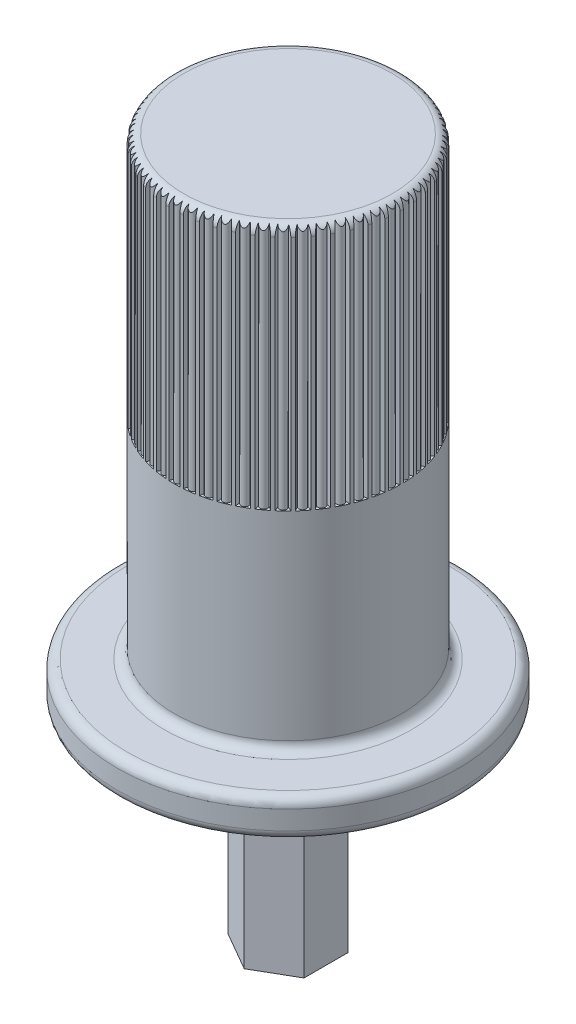
from build123d import *

# Parameters (mm, degrees)
FILLET1_R           = 0.25
CUT_EXTRUDE1_DEPTH  = 6.5
CIRPATTERN1_COUNT   = 50
FILLET2_R           = 0.25
BOSS_EXTRUDE1_DEPTH = 5.5


with BuildPart() as part:
    # Sketch1 → Revolve1 (revolve)
    with BuildSketch(Plane.XY):
        Polygon((0, 0), (0, 13), (-3, 13), (-3, 1), (-4.5, 1), (-4.5, 0), align=None)
    revolve(axis=Axis((0, 0, 0), (0, 1, 0)))

    # Fillet1
    fillet1_edges = [part.edges().sort_by_distance(p)[0] for p in [
        (3, 13, 0),
    ]]
    fillet(fillet1_edges, radius=FILLET1_R)

    # Sketch2 → Cut-Extrude1 (cut)
    with BuildSketch(Plane(origin=(0, 13, 0), x_dir=(1, 0, 0), z_dir=(0, 1, 0))):
        with BuildLine():
            Line((-0.099984876, 2.87326087), (-0.25, 3.27326087))
            Line((-0.25, 3.27326087), (0.25, 3.27326087))
            Line((0.25, 3.27326087), (0.099984876, 2.87326087))
            ThreePointArc((0.099984876, 2.87326087), (0, 2.975), (-0.099984876, 2.87326087))
        make_face()
    cut_extrude1 = extrude(amount=-CUT_EXTRUDE1_DEPTH, mode=Mode.SUBTRACT)

    # CirPattern1: Cut-Extrude1 ×50 about axis
    cirpattern1_axis = Axis((0, 0, 0), (0, -1, 0))
    for i in range(1, CIRPATTERN1_COUNT):
        add(cut_extrude1.rotate(cirpattern1_axis, i * 360 / CIRPATTERN1_COUNT), mode=Mode.SUBTRACT)

    # Fillet2
    fillet2_edges = [part.edges().sort_by_distance(p)[0] for p in [
        (4.5, 0, 0),
        (3, 1, 0),
        (4.5, 1, 0),
    ]]
    fillet(fillet2_edges, radius=FILLET2_R)

    # Sketch3 → Boss-Extrude1 (add)
    with BuildSketch(Plane(origin=(0, 0, 0), x_dir=(1, 0, 0), z_dir=(0, 1, 0))):
        Polygon((0, 1.154700538), (-1, 0.577350269), (-1, -0.577350269), (0, -1.154700538), (1, -0.577350269), (1, 0.577350269), align=None)
    extrude(amount=-BOSS_EXTRUDE1_DEPTH)


solid = part.part
